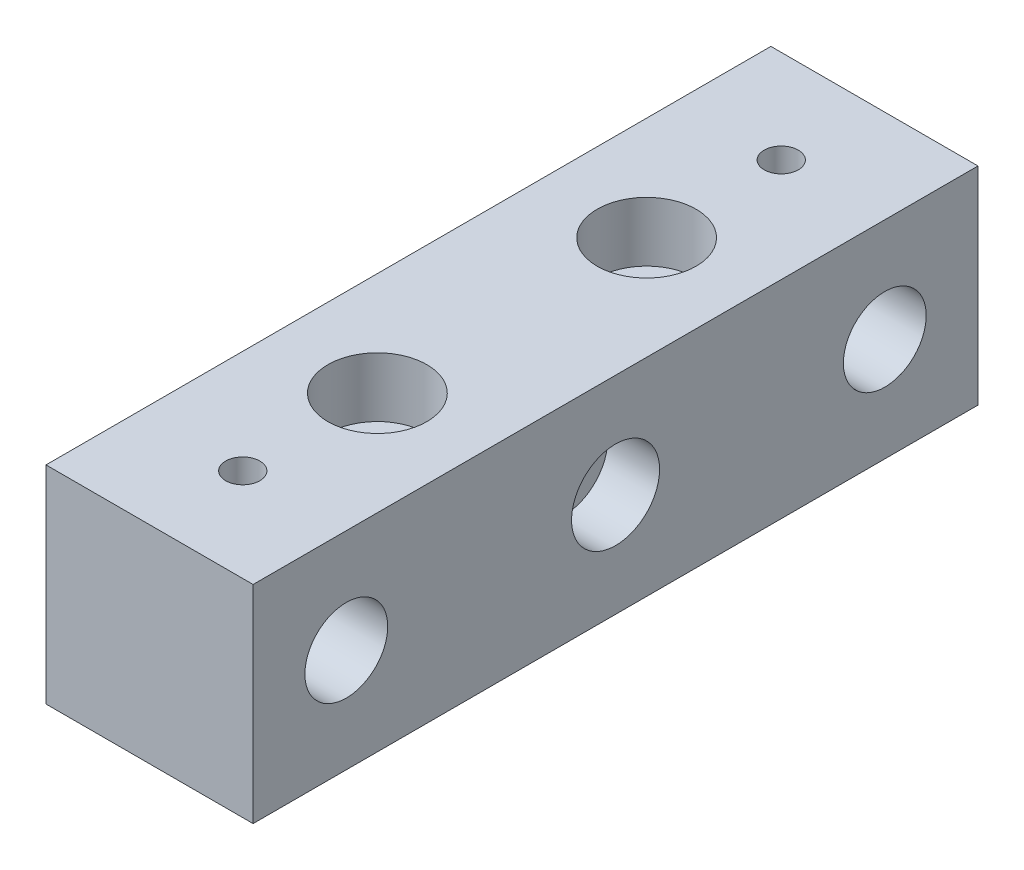
from build123d import *

# Parameters (mm, degrees)
ESBO_O1_W             = 20
ESBO_O1_H             = 70
FLANGE_BASE1_DEPTH    = 20
ESBO_O2_R             = 4.775
CORTE_EXTRUS_O1_DEPTH = 5.75
ESBO_O3_R             = 2.65
CORTE_EXTRUS_O2_DEPTH = 40.090440008
ESBO_O4_R             = 4
CORTE_EXTRUS_O3_DEPTH = 46
ESBO_O6_R             = 1.65
CORTE_EXTRUS_O4_DEPTH = 10
ESBO_O8_R             = 4.25
CORTE_EXTRUS_O6_DEPTH = 5


# Sheet-metal steps are written as plain solids
with BuildPart() as part:
    # Esboço1 → Flange-base1 (new body)
    with BuildSketch(Plane(origin=(0, 0, 0), x_dir=(1, 0, 0), z_dir=(0, 1, 0))):
        Rectangle(ESBO_O1_W, ESBO_O1_H)
    extrude(amount=-FLANGE_BASE1_DEPTH)

    # Esboço2 → Corte-extrusão1 (cut)
    with BuildSketch(Plane(origin=(0, 0, 0), x_dir=(1, 0, 0), z_dir=(0, 1, 0))):
        with Locations(Location((0, 13, 0), (0, 0, 270))):
            Circle(ESBO_O2_R)
        with Locations(Location((0, -13, 0), (0, 0, 270))):
            Circle(ESBO_O2_R)
    extrude(amount=-CORTE_EXTRUS_O1_DEPTH, mode=Mode.SUBTRACT)

    # Esboço3 → Corte-extrusão2 (cut, through all)
    with BuildSketch(Plane(origin=(0, -5.75, 0), x_dir=(1, 0, 0), z_dir=(0, 1, 0))):
        with Locations(Location((0, 13, 0), (0, 0, 270))):
            Circle(ESBO_O3_R)
        with Locations(Location((0, -13, 0), (0, 0, 270))):
            Circle(ESBO_O3_R)
    extrude(amount=-CORTE_EXTRUS_O2_DEPTH, mode=Mode.SUBTRACT)

    # Esboço4 → Corte-extrusão3 (cut, through all)
    with BuildSketch(Plane.ZY.offset(10)):
        with Locations((26, -10)):
            Circle(ESBO_O4_R)
        with Locations((-26, -10)):
            Circle(ESBO_O4_R)
    extrude(amount=-CORTE_EXTRUS_O3_DEPTH, mode=Mode.SUBTRACT)

    # Esboço6 → Corte-extrusão4 (cut)
    with BuildSketch(Plane(origin=(0, 0, 0), x_dir=(1, 0, 0), z_dir=(0, 1, 0))):
        with Locations(Location((0, -26, 0), (0, 0, 270))):
            Circle(ESBO_O6_R)
        with Locations(Location((0, 26, 0), (0, 0, 270))):
            Circle(ESBO_O6_R)
    extrude(amount=-CORTE_EXTRUS_O4_DEPTH, mode=Mode.SUBTRACT)

    # Esboço8 → Corte-extrusão6 (cut)
    with BuildSketch(Plane(origin=(10, 0, 0), x_dir=(0, 0, -1), z_dir=(1, 0, 0))):
        with Locations((0, -10)):
            Circle(ESBO_O8_R)
    extrude(amount=-CORTE_EXTRUS_O6_DEPTH, mode=Mode.SUBTRACT)


solid = part.part
